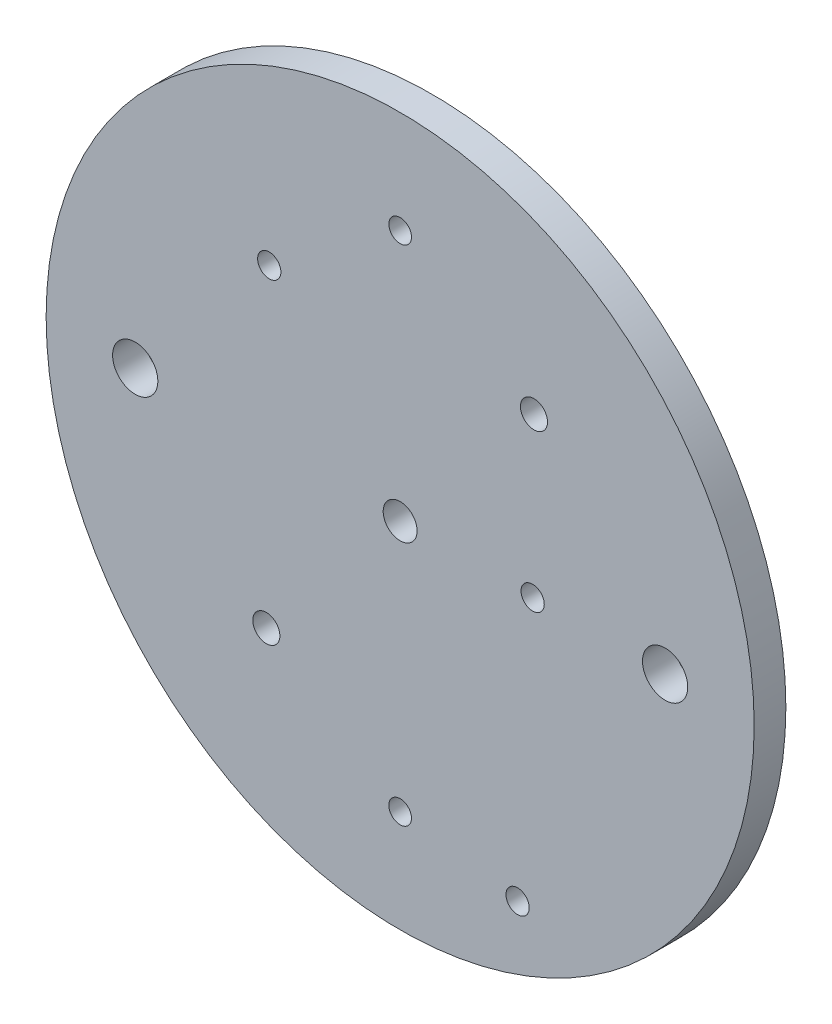
from build123d import *

# Parameters (mm, degrees)
SKETCH1_R                    = 49.6697
BOSS_EXTRUDE1_DEPTH          = 4.445
SKETCH2_R                    = 2.38125
SKETCH2_R_2                  = 3.175
CUT_EXTRUDE1_DEPTH           = 71.384062267
F_4_CLEARANCE_HOLE1_D        = 3.2639
F_6_CLEARANCE_HOLE1_D        = 3.7973
F_1_8_0_125_DIAMETER_HOLE1_D = 3.175
CIRPATTERN1_COUNT            = 2
CIRPATTERN1_ANGLE            = 180


with BuildPart() as part:
    # Sketch1 → Boss-Extrude1 (new body)
    with BuildSketch(Plane.XY):
        Circle(SKETCH1_R)
    extrude(amount=BOSS_EXTRUDE1_DEPTH)

    # Sketch2 → Cut-Extrude1 (cut, through all)
    with BuildSketch(Plane.XY.offset(4.445)):
        Circle(SKETCH2_R)
        with Locations((37.1729, 0)):
            Circle(SKETCH2_R_2)
        with Locations((-37.1729, 0)):
            Circle(SKETCH2_R_2)
    extrude(amount=-CUT_EXTRUDE1_DEPTH, mode=Mode.SUBTRACT)

    # #4 Clearance Hole1 (through all)
    with Locations(Plane.XY.offset(4.445)):
        with Locations((-18.367655947, 21.889719962), (18.58645, 0), (16.478058245, -37.941463918)):
            Hole(F_4_CLEARANCE_HOLE1_D / 2)

    # #6 Clearance Hole1 (through all)
    with Locations(Plane.XY.offset(4.445)):
        with Locations((18.775826079, 22.376158184)):
            f_6_clearance_hole1 = Hole(F_6_CLEARANCE_HOLE1_D / 2)

    # 1/8 (0.125) Diameter Hole1 (through all)
    with Locations(Plane.XY.offset(4.445)):
        with Locations((0, 35.306)):
            f_1_8_0_125_diameter_hole1 = Hole(F_1_8_0_125_DIAMETER_HOLE1_D / 2)

    # CirPattern1: #6 Clearance Hole1, 1/8 (0.125) Diameter Hole1 ×2 about axis
    cirpattern1_axis = Axis((0, 0, 0), (0, 0, 1))
    add([f_6_clearance_hole1.rotate(cirpattern1_axis, i * CIRPATTERN1_ANGLE / (CIRPATTERN1_COUNT - 1)) for i in range(1, CIRPATTERN1_COUNT)], mode=Mode.SUBTRACT)
    add([f_1_8_0_125_diameter_hole1.rotate(cirpattern1_axis, i * CIRPATTERN1_ANGLE / (CIRPATTERN1_COUNT - 1)) for i in range(1, CIRPATTERN1_COUNT)], mode=Mode.SUBTRACT)


solid = part.part
